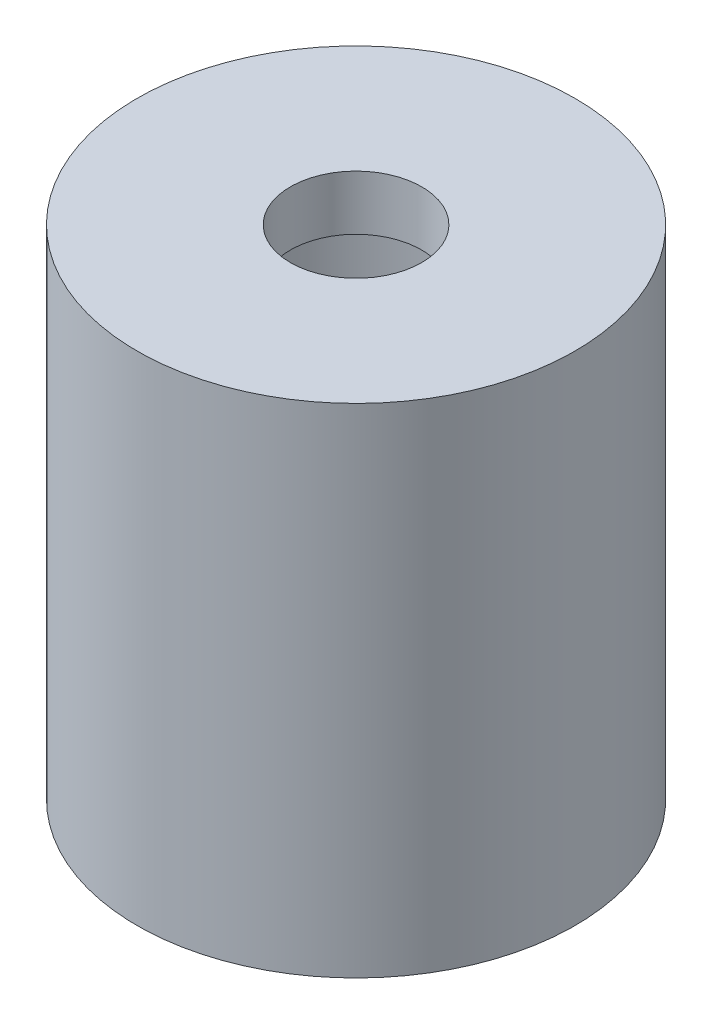
from build123d import *

# Parameters (mm, degrees)
SCHIZZO2_R               = 6
TAGLIO_ESTRUSIONE1_DEPTH = 11


with BuildPart() as part:
    # Schizzo1 → Rivoluzione1 (revolve)
    with BuildSketch(Plane.XY):
        Polygon((-18, 0), (-14, 0), (-14, 30), (0, 30), (0, 35), (-20, 35), (-20, -10.457904347), (-18, -10.457904347), align=None)
    revolve(axis=Axis((0, 0, 0), (0, 1, 0)))

    # Schizzo2 → Taglio-Estrusione1 (cut)
    with BuildSketch(Plane(origin=(0, 35, 0), x_dir=(1, 0, 0), z_dir=(0, 1, 0))):
        Circle(SCHIZZO2_R)
    extrude(amount=-TAGLIO_ESTRUSIONE1_DEPTH, mode=Mode.SUBTRACT)


solid = part.part
